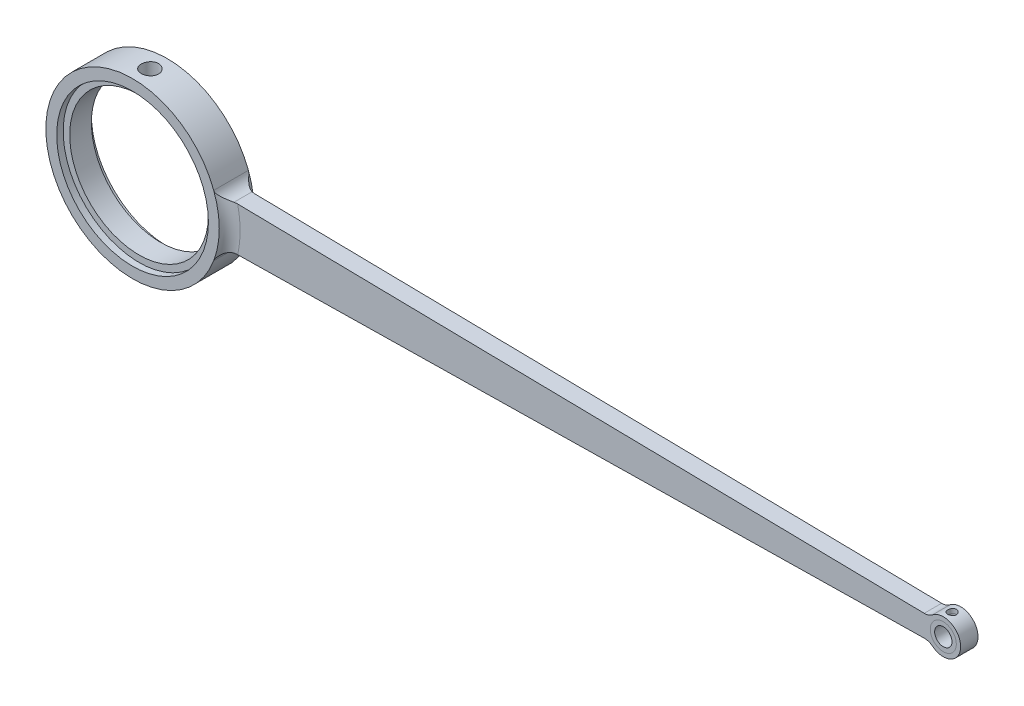
from build123d import *

# Parameters (mm, degrees)
SKETCH1_R           = 20
SKETCH1_R_2         = 17.5
BOSS_EXTRUDE1_DEPTH = 4
SKETCH2_R           = 4
SKETCH2_R_2         = 3
BOSS_EXTRUDE2_DEPTH = 2
BOSS_EXTRUDE3_DEPTH = 2
FILLET2_R           = 3
SKETCH4_R           = 17.5
SKETCH4_R_2         = 16
BOSS_EXTRUDE4_DEPTH = 2.5
SKETCH5_R           = 3
SKETCH5_R_2         = 2
BOSS_EXTRUDE5_DEPTH = 4
SKETCH6_R           = 2
SKETCH6_R_2         = 1
CUT_EXTRUDE1_DEPTH  = 191.097343487


with BuildPart() as part:
    # Sketch1 → Boss-Extrude1 (new, symmetric)
    with BuildSketch(Plane.XY):
        Circle(SKETCH1_R)
        Circle(SKETCH1_R_2, mode=Mode.SUBTRACT)
    extrude(amount=BOSS_EXTRUDE1_DEPTH, both=True)



with BuildPart() as body_2:
    # Sketch2 → Boss-Extrude2 (new, symmetric)
    with BuildSketch(Plane.XY):
        with Locations((185, 0)):
            Circle(SKETCH2_R)
        with Locations((185, 0)):
            Circle(SKETCH2_R_2, mode=Mode.SUBTRACT)
    extrude(amount=BOSS_EXTRUDE2_DEPTH, both=True)


with BuildPart() as part_1:
    add(part.part)

    add(body_2.part)  # Boss-Extrude3 merges body 2
    # Sketch3 → Boss-Extrude3 (add, symmetric)
    with BuildSketch(Plane.XY):
        with BuildLine():
            Line((19.334803677, 5.115209357), (181.847093747, 2.461540607))
            ThreePointArc((181.847093747, 2.461540607), (181, 0), (181.847093747, -2.461540607))
            Line((181.847093747, -2.461540607), (19.334803677, -5.115209357))
            ThreePointArc((19.334803677, -5.115209357), (20, 0), (19.334803677, 5.115209357))
        make_face()
    extrude(amount=BOSS_EXTRUDE3_DEPTH, both=True)

    # Fillet2
    # the kernel refuses this fillet: 3 mm, written as the material it adds along each edge
    with BuildSketch(Plane(origin=(0, 0, -2), x_dir=(1, 0, 0), z_dir=(0, -1, 0))) as fillet2_piece_1_section:
        with BuildLine():
            CenterArc((22.828427125, -3), FILLET2_R, 90, 70.528779366)
            Line((22.828427125, 0), (22.828427125, 0.06))
            Line((22.828427125, 0.06), (20, 0.06))
            Line((20, 0.06), (19.94, 0))
            ThreePointArc((19.94, 0), (19.94, -1), (19.943431458, -1.98))
            Line((19.943431458, -1.98), (20, -2))
        make_face()
    fillet2_piece_1 = revolve(axis=Axis((0, 0, -2), (0, 0, 1)), revolution_arc=35.075988766, mode=Mode.PRIVATE)
    fillet2_piece_1 = split(fillet2_piece_1, bisect_by=Plane(origin=(20.50402636, 5.09611708, -2.514287823), z_dir=(-0.01632685771654534, -0.99986670797517, 0)), keep=Keep.TOP, mode=Mode.PRIVATE)
    add(fillet2_piece_1)
    with BuildSketch(Plane(origin=(19.334803677, 5.115209357, 2), x_dir=(0.99986670797517, -0.01632685771654477, 0), z_dir=(0, 0, -1))) as fillet2_piece_2:
        with BuildLine():
            CenterArc((2.150626595, -3), FILLET2_R, 90, 68.498190281)
            Line((-0.640591379, -1.900408157), (-0.696415739, -1.87841632))
            ThreePointArc((-0.696415739, -1.87841632), (-0.353317386, -0.939073094), (-0.057746134, 0.016290612))
            Line((-0.057746134, 0.016290612), (0, 0.06))
            Line((0, 0.06), (2.150626595, 0.06))
            Line((2.150626595, 0.06), (2.150626595, 0))
        make_face()
    extrude(amount=4)
    with BuildSketch(Plane(origin=(19.334803677, -5.115209357, -2), x_dir=(-0.3039080161751765, -0.9527013790818551, 0), z_dir=(0, 0, 1))) as fillet2_piece_3:
        with BuildLine():
            CenterArc((2.155879863, 2.996227088), FILLET2_R, 198.627981215, 68.498190281)
            Line((-0.686957722, 2.037960706), (-0.743814474, 2.018795378))
            Line((-0.743814474, 2.018795378), (-0.056856752, -0.019165328))
            Line((-0.056856752, -0.019165328), (0.003008204, -0.059924542))
            ThreePointArc((0.003008204, -0.059924542), (1.00273482, -0.034847255), (2.002461436, -0.059924542))
            Line((2.002461436, -0.059924542), (2.00546964, 0))
        make_face()
    extrude(amount=4)
    with BuildSketch(Plane(origin=(181.847093747, -2.461540607, -2), x_dir=(0.7041582236338697, -0.7100430945293342, 0), z_dir=(0, 0, 1)), Plane(origin=(181.847093747, 2.461540607, 2), x_dir=(0.7041582236338706, 0.7100430945293335, 0), z_dir=(0, 0, -1))) as fillet2_piece_4:
        with BuildLine():
            CenterArc((1.298948631, -2.97901003), FILLET2_R, 96.781666847, 39.392256485)
            Line((-0.865386796, -0.901595253), (-0.908673505, -0.860046958))
            Line((-0.908673505, -0.860046958), (-0.043286709, 0.041548296))
            Line((-0.043286709, 0.041548296), (0.007085174, 0.059580201))
            ThreePointArc((0.007085174, 0.059580201), (0.472344957, 0.032013374), (0.937604739, 0.059580201))
            Line((0.937604739, 0.059580201), (0.944689914, 0))
        make_face()
    extrude(amount=4)
    with BuildSketch(Plane(origin=(0, 0, 2), x_dir=(1, 0, 0), z_dir=(0, -1, 0))) as fillet2_piece_5_section:
        with BuildLine():
            CenterArc((22.828427125, 3), FILLET2_R, 199.471220634, 70.528779366)
            Line((22.828427125, 0), (22.828427125, -0.06))
            Line((22.828427125, -0.06), (20, -0.06))
            Line((20, -0.06), (19.94, 0))
            ThreePointArc((19.94, 0), (19.94, 1), (19.943431458, 1.98))
            Line((19.943431458, 1.98), (20, 2))
        make_face()
    fillet2_piece_5 = revolve(axis=Axis((0, 0, 2), (0, 0, 1)), revolution_arc=35.075988766, mode=Mode.PRIVATE)
    fillet2_piece_5 = split(fillet2_piece_5, bisect_by=Plane(origin=(20.50402636, 5.09611708, 2.514287823), z_dir=(-0.01632685771654534, -0.99986670797517, 0)), keep=Keep.TOP, mode=Mode.PRIVATE)
    add(fillet2_piece_5)
    with BuildSketch(Plane(origin=(0, 0, 2), x_dir=(0.8183906159507496, -0.574662335396842, 0), z_dir=(-0.574662335396842, -0.8183906159507496, 0))) as fillet2_piece_6_section:
        with BuildLine():
            CenterArc((22.828427125, 3), FILLET2_R, 199.471220634, 70.528779366)
            Line((22.828427125, 0), (22.828427125, -0.06))
            Line((22.828427125, -0.06), (20, -0.06))
            Line((20, -0.06), (19.94, 0))
            ThreePointArc((19.94, 0), (19.94, 1), (19.943431458, 1.98))
            Line((19.943431458, 1.98), (20, 2))
        make_face()
    fillet2_piece_6 = revolve(axis=Axis((0, 0, 2), (0, 0, 1)), revolution_arc=35.075988766, mode=Mode.PRIVATE)
    fillet2_piece_6 = split(fillet2_piece_6, bisect_by=Plane(origin=(20.504025944, -5.096117086, 2.514287966), z_dir=(-0.01632685771654534, 0.99986670797517, 0)), keep=Keep.TOP, mode=Mode.PRIVATE)
    add(fillet2_piece_6)
    with BuildSketch(Plane(origin=(0, 0, -2), x_dir=(0.8183906159507496, -0.574662335396842, 0), z_dir=(-0.574662335396842, -0.8183906159507496, 0))) as fillet2_piece_7_section:
        with BuildLine():
            CenterArc((22.828427125, -3), FILLET2_R, 90, 70.528779366)
            Line((22.828427125, 0), (22.828427125, 0.06))
            Line((22.828427125, 0.06), (20, 0.06))
            Line((20, 0.06), (19.94, 0))
            ThreePointArc((19.94, 0), (19.94, -1), (19.943431458, -1.98))
            Line((19.943431458, -1.98), (20, -2))
        make_face()
    fillet2_piece_7 = revolve(axis=Axis((0, 0, -2), (0, 0, 1)), revolution_arc=35.075988766, mode=Mode.PRIVATE)
    fillet2_piece_7 = split(fillet2_piece_7, bisect_by=Plane(origin=(20.504025944, -5.096117086, -2.514287966), z_dir=(-0.01632685771654534, 0.99986670797517, 0)), keep=Keep.TOP, mode=Mode.PRIVATE)
    add(fillet2_piece_7)
    with BuildSketch(Plane(origin=(19.334803677, 5.115209357, 2), x_dir=(0.99986670797517, -0.01632685771654477, 0), z_dir=(0, 0, -1))) as fillet2_piece_8a_section:
        with BuildLine():
            CenterArc((2.150626595, -3), FILLET2_R, 90, 68.498190281)
            Line((-0.640591379, -1.900408157), (-0.696415739, -1.87841632))
            ThreePointArc((-0.696415739, -1.87841632), (-0.353317386, -0.939073094), (-0.057746134, 0.016290612))
            Line((-0.057746134, 0.016290612), (0, 0.06))
            Line((0, 0.06), (2.150626595, 0.06))
            Line((2.150626595, 0.06), (2.150626595, 0))
        make_face()
    fillet2_piece_8a = extrude(amount=9.376566487, mode=Mode.PRIVATE)
    fillet2_piece_8a = split(fillet2_piece_8a, bisect_by=Plane(origin=(19.695390581, 5.526512095, -2), z_dir=(0, 0, -1)), keep=Keep.TOP, mode=Mode.PRIVATE)
    fillet2_piece_8a = split(fillet2_piece_8a, bisect_by=Plane(origin=(19.695390581, 5.526512095, -4), z_dir=(0, 0, 1)), keep=Keep.TOP, mode=Mode.PRIVATE)
    with BuildSketch(Plane(origin=(0, 0, -2), x_dir=(1, 0, 0), z_dir=(0, -1, 0))) as fillet2_piece_8b_section:
        with BuildLine():
            CenterArc((22.828427125, -3), FILLET2_R, 90, 70.528779366)
            Line((22.828427125, 0), (22.828427125, 0.06))
            Line((22.828427125, 0.06), (20, 0.06))
            Line((20, 0.06), (19.94, 0))
            ThreePointArc((19.94, 0), (19.94, -1), (19.943431458, -1.98))
            Line((19.943431458, -1.98), (20, -2))
        make_face()
    fillet2_piece_8b = revolve(axis=Axis((0, 0, -2), (0, 0, 1)), revolution_arc=35.075988766, mode=Mode.PRIVATE)
    fillet2_piece_8b = split(fillet2_piece_8b, bisect_by=Plane(origin=(18.660284546, 5.126223603, -2.498924184), z_dir=(0.01632685771654534, 0.99986670797517, 0)), keep=Keep.TOP, mode=Mode.PRIVATE)
    fillet2_piece_8 = fillet2_piece_8a & fillet2_piece_8b
    add(fillet2_piece_8)
    with BuildSketch(Plane(origin=(19.334803677, 5.115209357, 7.376566487), x_dir=(0.99986670797517, -0.016326857716544716, 0), z_dir=(0, 0, -1))) as fillet2_piece_9a_section:
        with BuildLine():
            CenterArc((2.150626595, -3), FILLET2_R, 90, 68.498190281)
            Line((-0.640591379, -1.900408157), (-0.696415739, -1.87841632))
            ThreePointArc((-0.696415739, -1.87841632), (-0.353317386, -0.939073094), (-0.057746134, 0.016290612))
            Line((-0.057746134, 0.016290612), (0, 0.06))
            Line((0, 0.06), (2.150626595, 0.06))
            Line((2.150626595, 0.06), (2.150626595, 0))
        make_face()
    fillet2_piece_9a = extrude(amount=9.376566487, mode=Mode.PRIVATE)
    fillet2_piece_9a = split(fillet2_piece_9a, bisect_by=Plane(origin=(19.695390581, 5.526512095, 2), z_dir=(0, 0, 1)), keep=Keep.TOP, mode=Mode.PRIVATE)
    fillet2_piece_9a = split(fillet2_piece_9a, bisect_by=Plane(origin=(19.695390581, 5.526512095, 4), z_dir=(0, 0, -1)), keep=Keep.TOP, mode=Mode.PRIVATE)
    with BuildSketch(Plane(origin=(0, 0, 2), x_dir=(1, 0, 0), z_dir=(0, -1, 0))) as fillet2_piece_9b_section:
        with BuildLine():
            CenterArc((22.828427125, 3), FILLET2_R, 199.471220634, 70.528779366)
            Line((22.828427125, 0), (22.828427125, -0.06))
            Line((22.828427125, -0.06), (20, -0.06))
            Line((20, -0.06), (19.94, 0))
            ThreePointArc((19.94, 0), (19.94, 1), (19.943431458, 1.98))
            Line((19.943431458, 1.98), (20, 2))
        make_face()
    fillet2_piece_9b = revolve(axis=Axis((0, 0, 2), (0, 0, 1)), revolution_arc=35.075988766, mode=Mode.PRIVATE)
    fillet2_piece_9b = split(fillet2_piece_9b, bisect_by=Plane(origin=(18.660284546, 5.126223603, 2.498924184), z_dir=(0.01632685771654534, 0.99986670797517, 0)), keep=Keep.TOP, mode=Mode.PRIVATE)
    fillet2_piece_9 = fillet2_piece_9a & fillet2_piece_9b
    add(fillet2_piece_9)
    with BuildSketch(Plane(origin=(19.334803677, -5.115209357, -7.376566487), x_dir=(-0.303908016175173, -0.9527013790818563, 0), z_dir=(0, 0, 1))) as fillet2_piece_10a_section:
        with BuildLine():
            CenterArc((2.155879863, 2.996227088), FILLET2_R, 198.627981215, 68.498190281)
            Line((-0.686957722, 2.037960706), (-0.743814474, 2.018795378))
            Line((-0.743814474, 2.018795378), (-0.056856752, -0.019165328))
            Line((-0.056856752, -0.019165328), (0.003008204, -0.059924542))
            ThreePointArc((0.003008204, -0.059924542), (1.00273482, -0.034847255), (2.002461436, -0.059924542))
            Line((2.002461436, -0.059924542), (2.00546964, 0))
        make_face()
    fillet2_piece_10a = extrude(amount=9.376566487, mode=Mode.PRIVATE)
    fillet2_piece_10a = split(fillet2_piece_10a, bisect_by=Plane(origin=(19.695390581, -5.526512095, -4), z_dir=(0, 0, 1)), keep=Keep.TOP, mode=Mode.PRIVATE)
    fillet2_piece_10a = split(fillet2_piece_10a, bisect_by=Plane(origin=(19.695390581, -5.526512095, -2), z_dir=(0, 0, -1)), keep=Keep.TOP, mode=Mode.PRIVATE)
    with BuildSketch(Plane(origin=(0, 0, -2), x_dir=(0.8183906159507496, -0.574662335396842, 0), z_dir=(-0.574662335396842, -0.8183906159507496, 0))) as fillet2_piece_10b_section:
        with BuildLine():
            CenterArc((22.828427125, -3), FILLET2_R, 90, 70.528779366)
            Line((22.828427125, 0), (22.828427125, 0.06))
            Line((22.828427125, 0.06), (20, 0.06))
            Line((20, 0.06), (19.94, 0))
            ThreePointArc((19.94, 0), (19.94, -1), (19.943431458, -1.98))
            Line((19.943431458, -1.98), (20, -2))
        make_face()
    fillet2_piece_10b = revolve(axis=Axis((0, 0, -2), (0, 0, 1)), revolution_arc=35.075988766, mode=Mode.PRIVATE)
    fillet2_piece_10b = split(fillet2_piece_10b, bisect_by=Plane(origin=(18.660284792, -5.126223599, -2.498924133), z_dir=(0.01632685771654534, -0.99986670797517, 0)), keep=Keep.TOP, mode=Mode.PRIVATE)
    fillet2_piece_10 = fillet2_piece_10a & fillet2_piece_10b
    add(fillet2_piece_10)
    with BuildSketch(Plane(origin=(0, 0, 2), x_dir=(0.8183906159507496, -0.574662335396842, 0), z_dir=(-0.574662335396842, -0.8183906159507496, 0))) as fillet2_piece_11a_section:
        with BuildLine():
            CenterArc((22.828427125, 3), FILLET2_R, 199.471220634, 70.528779366)
            Line((22.828427125, 0), (22.828427125, -0.06))
            Line((22.828427125, -0.06), (20, -0.06))
            Line((20, -0.06), (19.94, 0))
            ThreePointArc((19.94, 0), (19.94, 1), (19.943431458, 1.98))
            Line((19.943431458, 1.98), (20, 2))
        make_face()
    fillet2_piece_11a = revolve(axis=Axis((0, 0, 2), (0, 0, 1)), revolution_arc=35.075988766, mode=Mode.PRIVATE)
    fillet2_piece_11a = split(fillet2_piece_11a, bisect_by=Plane(origin=(18.660284792, -5.126223599, 2.498924133), z_dir=(0.01632685771654534, -0.99986670797517, 0)), keep=Keep.TOP, mode=Mode.PRIVATE)
    with BuildSketch(Plane(origin=(19.334803677, -5.115209357, -2), x_dir=(-0.3039080161751765, -0.9527013790818551, 0), z_dir=(0, 0, 1))) as fillet2_piece_11b_section:
        with BuildLine():
            CenterArc((2.155879863, 2.996227088), FILLET2_R, 198.627981215, 68.498190281)
            Line((-0.686957722, 2.037960706), (-0.743814474, 2.018795378))
            Line((-0.743814474, 2.018795378), (-0.056856752, -0.019165328))
            Line((-0.056856752, -0.019165328), (0.003008204, -0.059924542))
            ThreePointArc((0.003008204, -0.059924542), (1.00273482, -0.034847255), (2.002461436, -0.059924542))
            Line((2.002461436, -0.059924542), (2.00546964, 0))
        make_face()
    fillet2_piece_11b = extrude(amount=9.376566487, mode=Mode.PRIVATE)
    fillet2_piece_11b = split(fillet2_piece_11b, bisect_by=Plane(origin=(19.695390581, -5.526512095, 4), z_dir=(0, 0, -1)), keep=Keep.TOP, mode=Mode.PRIVATE)
    fillet2_piece_11b = split(fillet2_piece_11b, bisect_by=Plane(origin=(19.695390581, -5.526512095, 2), z_dir=(0, 0, 1)), keep=Keep.TOP, mode=Mode.PRIVATE)
    fillet2_piece_11 = fillet2_piece_11a & fillet2_piece_11b
    add(fillet2_piece_11)

    # Sketch4 → Boss-Extrude4 (add, symmetric)
    with BuildSketch(Plane.XY):
        Circle(SKETCH4_R)
        Circle(SKETCH4_R_2, mode=Mode.SUBTRACT)
    extrude(amount=BOSS_EXTRUDE4_DEPTH, both=True)


with BuildPart() as body_2_2:
    # Sketch5 → Boss-Extrude5 (new body)
    with BuildSketch(Plane.XY.offset(2)):
        with Locations((185, 0)):
            Circle(SKETCH5_R)
        with Locations((185, 0)):
            Circle(SKETCH5_R_2, mode=Mode.SUBTRACT)
    extrude(amount=-BOSS_EXTRUDE5_DEPTH)


with BuildPart() as cut_extrude1_tool:
    # Sketch6 → Cut-Extrude1 (new, through all)
    with BuildSketch(Plane(origin=(0, 0, 0), x_dir=(1, 0, 0), z_dir=(0, 1, 0))):
        with Locations(Location((0, 0, 0), (0, 0, 90))):
            Circle(SKETCH6_R)
        with Locations(Location((185, 0, 0), (0, 0, 90))):
            Circle(SKETCH6_R_2)
    extrude(amount=CUT_EXTRUDE1_DEPTH)


with BuildPart() as part_2:
    add(part_1.part)

    # Cut-Extrude1: cut by cut_extrude1_tool
    add(cut_extrude1_tool.part, mode=Mode.SUBTRACT)


with BuildPart() as body_2_2_1:
    add(body_2_2.part)

    # Cut-Extrude1: cut by cut_extrude1_tool
    add(cut_extrude1_tool.part, mode=Mode.SUBTRACT)


solid = Compound([part_2.part, body_2_2_1.part])
